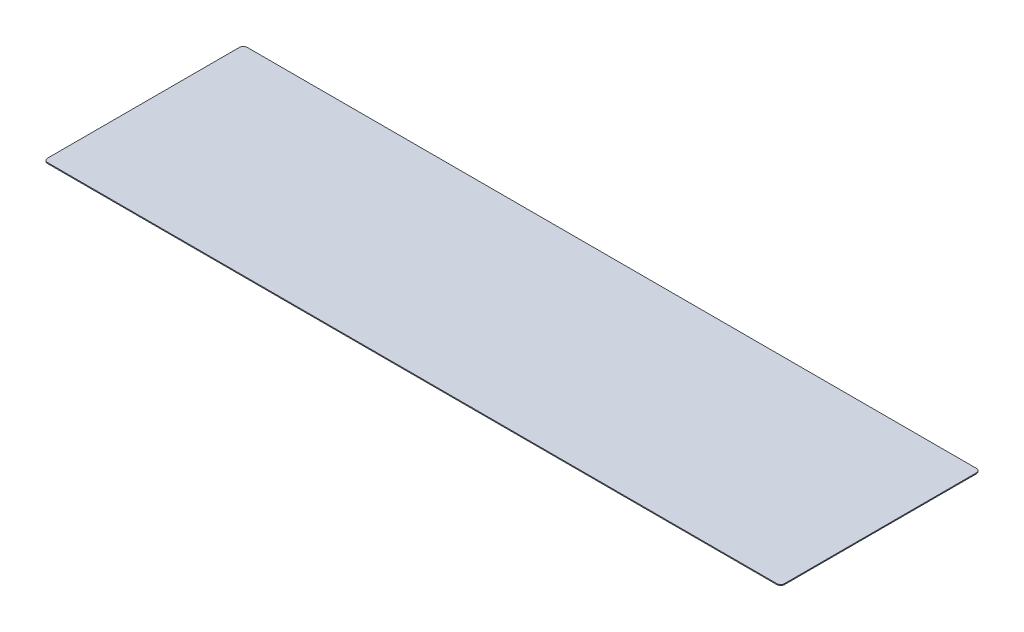
from build123d import *

# Parameters (mm, degrees)
BOSS_EXTRUDE1_DEPTH = 1.524


with BuildPart() as part:
    # Sketch1 → Boss-Extrude1 (new body)
    with BuildSketch(Plane(origin=(0, 0, 0), x_dir=(1, 0, 0), z_dir=(0, 1, 0))):
        with BuildLine():
            Line((6.35, 0), (1212.85, 0))
            ThreePointArc((1212.85, 0), (1217.340128061, 1.859871939), (1219.2, 6.35))
            Line((1219.2, 6.35), (1219.2, 323.85))
            ThreePointArc((1219.2, 323.85), (1217.340128061, 328.340128061), (1212.85, 330.2))
            Line((1212.85, 330.2), (6.35, 330.2))
            ThreePointArc((6.35, 330.2), (1.859871939, 328.340128061), (0, 323.85))
            Line((0, 323.85), (0, 6.35))
            ThreePointArc((0, 6.35), (1.859871939, 1.859871939), (6.35, 0))
        make_face()
    extrude(amount=BOSS_EXTRUDE1_DEPTH)


solid = part.part
